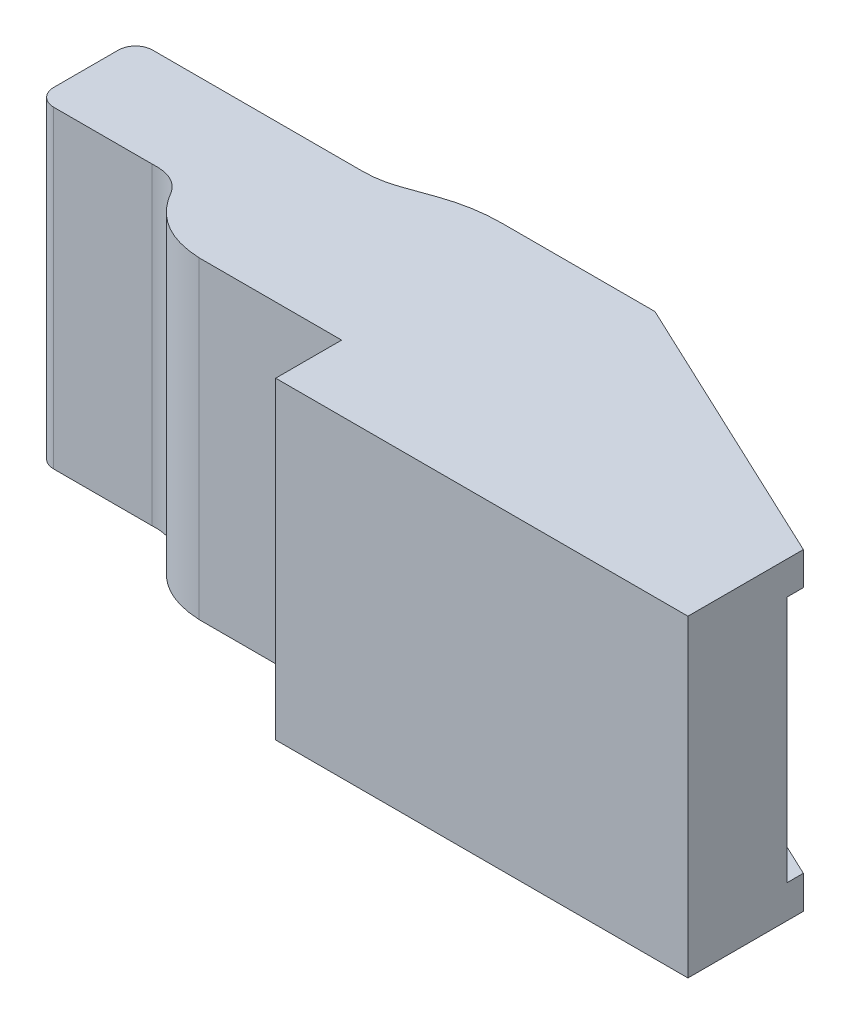
from build123d import *

# Parameters (mm, degrees)
BOSS_EXTRUDE1_DEPTH = 19
SHELL1_START        = 2
SHELL1_DEPTH        = 15
SKETCH3_W           = 1.941176471
SKETCH3_H           = 15
CUT_EXTRUDE1_DEPTH  = 19
SKETCH4_W           = 27
SKETCH4_H           = 15
CUT_EXTRUDE2_DEPTH  = 32
BOSS_EXTRUDE2_REACH = 53.488
SKETCH5_W           = 2
SKETCH5_H           = 15
BOSS_EXTRUDE3_DEPTH = 2
SKETCH9_W           = 25
SKETCH9_H           = 19
BOSS_EXTRUDE4_DEPTH = 4


# Read off the part's stored shape, not the designer's step: Shell1
with BuildPart() as part:
    # Sketch1 → Boss-Extrude1 (new body)
    with BuildSketch(Plane(origin=(0, 0, 0), x_dir=(1, 0, 0), z_dir=(0, 1, 0))):
        with BuildLine():
            Line((1.038993018, 3.5), (7, 3.5))
            add(Edge.make_bspline(
                [(7, 3.5), (8.459278233, 3.59711175), (9.130651495, 2.496759959)],
                knots=[0, 0, 0, 1, 1, 1], degree=2))
            add(Edge.make_bspline(
                [(13.357309771, 0), (11.472981218, 0.082883183), (10.064095126, 0.915136502), (9.130651495, 2.496759959)],
                knots=[0.099588888, 0.099588888, 0.099588888, 0.099588888, 1, 1, 1, 1], degree=3))
            Line((13.357309771, 0), (47, 0))
            Line((47, 0), (47, 3))
            Line((47, 3), (30, 11))
            Line((30, 11), (20.724531658, 11))
            ThreePointArc((20.724531658, 11), (19.025085695, 10.854536185), (17.375081312, 10.422376684))
            Line((17.375081312, 10.422376684), (15.713240119, 9.83162822))
            ThreePointArc((15.713240119, 9.83162822), (14.765930685, 9.583514472), (13.790235586, 9.5))
            Line((13.790235586, 9.5), (1.038993018, 9.5))
            ThreePointArc((1.038993018, 9.5), (0.304314009, 9.195685991), (0, 8.461006982))
            Line((0, 8.461006982), (0, 4.538993018))
            ThreePointArc((0, 4.538993018), (0.304314009, 3.804314009), (1.038993018, 3.5))
        make_face()
    extrude(amount=BOSS_EXTRUDE1_DEPTH)

    # Shell1 outline → Shell1 (cut)
    with BuildSketch(Plane(origin=(0, 0, 0), x_dir=(1, 0, 0), z_dir=(0, 1, 0)).offset(SHELL1_START)):
        with BuildLine():
            Line((2, 5.5), (6.940673062, 5.500000119))
            add(Edge.make_bspline(
                [(6.940673062, 5.500000119), (7.109177951, 5.50902653), (7.278234995, 5.512602664), (7.447878181, 5.510422658), (7.618098093, 5.502157784), (7.78882908, 5.487449259), (7.959932498, 5.465914346), (8.131179576, 5.437162857), (8.302237446, 5.400821142), (8.47266191, 5.356560666), (8.641900457, 5.304128263), (8.809309112, 5.243375169), (8.974186651, 5.174281921), (9.219363913, 5.057026039), (9.302034833, 5.014883346), (9.383743481, 4.970562513), (9.464391034, 4.924089732), (9.543880108, 4.875502014), (9.622116004, 4.824846185), (9.699007976, 4.772177888), (9.774470476, 4.71756058), (9.848424417, 4.661064529), (9.920798428, 4.602765816), (9.991530106, 4.542745331), (10.060567276, 4.481087773), (10.161520229, 4.386277087), (10.194737041, 4.354285549), (10.227514411, 4.321917126), (10.25984764, 4.289182819), (10.291732596, 4.256093529), (10.323165718, 4.222660069), (10.354144009, 4.188893152), (10.384665044, 4.154803401), (10.414726966, 4.120401341), (10.444328485, 4.085697407), (10.47346888, 4.050701936), (10.502148, 4.015425173), (10.544475391, 3.962103314), (10.558469269, 3.944261494), (10.572347936, 3.926353044), (10.586111461, 3.908379178), (10.599759937, 3.890341094), (10.613293488, 3.872239973), (10.626712261, 3.854076975), (10.640016431, 3.835853244), (10.6532062, 3.817569903), (10.666281796, 3.799228059), (10.679243473, 3.7808288), (10.692091515, 3.762373195), (10.711193584, 3.734606845), (10.717532595, 3.725337582), (10.723843304, 3.716054631), (10.730125756, 3.706758115), (10.736379994, 3.697448159), (10.742606064, 3.688124887), (10.748804009, 3.678788423), (10.754973874, 3.669438891), (10.761115703, 3.660076416), (10.76722954, 3.650701121), (10.77331543, 3.641313131), (10.779373416, 3.63191257), (10.788418607, 3.617793057), (10.791426708, 3.613083439), (10.794427853, 3.608370721), (10.797422049, 3.603654918), (10.800409303, 3.598936043), (10.803389621, 3.594214111), (10.806363009, 3.589489136), (10.809329475, 3.584761133), (10.812289025, 3.580030115), (10.815241666, 3.575296097), (10.818187405, 3.570559093), (10.821126247, 3.565819118), (10.824791189, 3.559890452), (10.825523747, 3.558704534), (10.826255874, 3.557518432), (10.826987571, 3.556332144), (10.827718838, 3.555145673), (10.828449675, 3.553959018), (10.829180081, 3.552772178), (10.829910058, 3.551585155), (10.830639605, 3.550397949), (10.831368723, 3.54921056), (10.83209741, 3.548022987), (10.832825669, 3.546835232), (10.833735455, 3.54535031), (10.833917386, 3.545053315), (10.834099289, 3.544756307), (10.834281166, 3.544459289), (10.834463016, 3.544162259), (10.834644839, 3.543865217), (10.834826636, 3.543568164), (10.835008405, 3.5432711), (10.835190148, 3.542974025), (10.835371864, 3.542676938), (10.835553553, 3.542379839), (10.835735215, 3.54208273), (10.836007668, 3.541637048), (10.836098479, 3.541488485), (10.836189283, 3.541339918), (10.836280081, 3.541191349), (10.836370872, 3.541042777), (10.836461656, 3.540894203), (10.836552434, 3.540745625), (10.836643204, 3.540597045), (10.836733968, 3.540448461), (10.836824726, 3.540299875), (10.836915476, 3.540151286), (10.83700622, 3.540002694), (10.837142326, 3.539779803), (10.837187693, 3.539705504), (10.837233059, 3.539631206), (10.837278422, 3.539556906), (10.837323784, 3.539482606), (10.837369144, 3.539408305), (10.837414503, 3.539334004), (10.83745986, 3.539259701), (10.837505215, 3.539185398), (10.837550569, 3.539111095), (10.83759592, 3.53903679), (10.837641271, 3.538962485), (10.837697956, 3.538869603), (10.837709293, 3.538851026), (10.83772063, 3.53883245), (10.837731967, 3.538813873), (10.837743304, 3.538795297), (10.83775464, 3.53877672), (10.837765977, 3.538758143), (10.837777313, 3.538739566), (10.83778865, 3.53872099), (10.837799986, 3.538702413), (10.837811322, 3.538683836), (10.837822658, 3.538665259), (10.837839662, 3.538637393), (10.83784533, 3.538628105), (10.837850998, 3.538618816), (10.837856665, 3.538609528), (10.837862333, 3.538600239), (10.837868001, 3.538590951), (10.837873669, 3.538581662), (10.837879336, 3.538572374), (10.837885004, 3.538563085), (10.837890672, 3.538553797), (10.83789634, 3.538544508), (10.837902007, 3.538535219), (10.837913343, 3.538516642), (10.837916038, 3.538512225), (10.837946561, 3.538462199), (10.83784979, 3.538620803), (10.838122406, 3.538173997), (10.837653087, 3.53894319), (10.838244889, 3.537973253), (10.837760219, 3.538767605), (10.838033901, 3.538319054), (10.837937534, 3.538476994), (10.837963449, 3.53843452), (10.837964102, 3.538433451), (10.83798002, 3.538407361), (10.837992755, 3.53838649), (10.838005489, 3.538365619), (10.838018224, 3.538344747), (10.838030958, 3.538323876), (10.838043693, 3.538303005), (10.838056427, 3.538282134), (10.838069162, 3.538261262), (10.838081896, 3.538240391), (10.838094631, 3.53821952), (10.838107365, 3.538198648), (10.8381201, 3.538177777), (10.838336586, 3.537822965), (10.838540338, 3.537489024), (10.838744091, 3.537155083), (10.838947843, 3.536821142), (10.839151595, 3.536487201), (10.839355347, 3.53615326), (10.839559099, 3.535819319), (10.839762851, 3.535485379), (10.839966603, 3.535151438), (10.840170355, 3.534817497), (10.840374107, 3.534483556), (10.840577859, 3.534149615), (10.841151786, 3.533208975), (10.84152196, 3.532602276), (10.841892134, 3.531995576), (10.842262308, 3.531388877), (10.842632482, 3.530782178), (10.843002656, 3.530175479), (10.84337283, 3.529568779), (10.843743004, 3.52896208), (10.844113178, 3.528355381), (10.844483352, 3.527748682), (10.844853526, 3.527141983), (10.8452237, 3.526535283), (10.845593874, 3.525928584)],
                knots=[0.016399164, 0.016399164, 0.016399164, 0.016399164, 0.016399164, 0.016399164, 0.016399164, 0.016399164, 0.016399164, 0.016399164, 0.016399164, 0.016399164, 0.016399164, 0.016399164, 0.505, 0.505, 0.505, 0.505, 0.505, 0.505, 0.505, 0.505, 0.505, 0.505, 0.505, 0.505, 0.7575, 0.7575, 0.7575, 0.7575, 0.7575, 0.7575, 0.7575, 0.7575, 0.7575, 0.7575, 0.7575, 0.7575, 0.88375, 0.88375, 0.88375, 0.88375, 0.88375, 0.88375, 0.88375, 0.88375, 0.88375, 0.88375, 0.88375, 0.88375, 0.946875, 0.946875, 0.946875, 0.946875, 0.946875, 0.946875, 0.946875, 0.946875, 0.946875, 0.946875, 0.946875, 0.946875, 0.9784375, 0.9784375, 0.9784375, 0.9784375, 0.9784375, 0.9784375, 0.9784375, 0.9784375, 0.9784375, 0.9784375, 0.9784375, 0.9784375, 0.99421875, 0.99421875, 0.99421875, 0.99421875, 0.99421875, 0.99421875, 0.99421875, 0.99421875, 0.99421875, 0.99421875, 0.99421875, 0.99421875, 0.998164063, 0.998164063, 0.998164063, 0.998164063, 0.998164063, 0.998164063, 0.998164063, 0.998164063, 0.998164063, 0.998164063, 0.998164063, 0.998164063, 0.999150391, 0.999150391, 0.999150391, 0.999150391, 0.999150391, 0.999150391, 0.999150391, 0.999150391, 0.999150391, 0.999150391, 0.999150391, 0.999150391, 0.999643555, 0.999643555, 0.999643555, 0.999643555, 0.999643555, 0.999643555, 0.999643555, 0.999643555, 0.999643555, 0.999643555, 0.999643555, 0.999643555, 0.999890137, 0.999890137, 0.999890137, 0.999890137, 0.999890137, 0.999890137, 0.999890137, 0.999890137, 0.999890137, 0.999890137, 0.999890137, 0.999890137, 0.999951782, 0.999951782, 0.999951782, 0.999951782, 0.999951782, 0.999951782, 0.999951782, 0.999951782, 0.999951782, 0.999951782, 0.999951782, 0.999951782, 0.999982605, 0.999982605, 0.999982605, 0.999982605, 0.999982605, 0.999982605, 0.999982605, 0.999982605, 0.999982605, 0.999982605, 0.999982605, 0.999982605, 1.000013428, 1.000013428, 1.000013428, 1.000013428, 1.000013428, 1.000013428, 1.000013428, 1.000013428, 1.000013428, 1.000013428, 1.000013428, 1.000013428, 1.000136719, 1.000136719, 1.000136719, 1.000136719, 1.000136719, 1.000136719, 1.000136719, 1.000136719, 1.000136719, 1.000136719, 1.000136719, 1.000136719, 1.002109375, 1.002109375, 1.002109375, 1.002109375, 1.002109375, 1.002109375, 1.002109375, 1.002109375, 1.002109375, 1.002109375, 1.002109375, 1.002109375, 1.00569327, 1.00569327, 1.00569327, 1.00569327, 1.00569327, 1.00569327, 1.00569327, 1.00569327, 1.00569327, 1.00569327, 1.00569327, 1.00569327, 1.00569327, 1.00569327], degree=13))
            add(Edge.make_bspline(
                [(13.40502786, 2.000000011), (13.264344282, 2.007348761), (13.129461459, 2.018818573), (13.000298688, 2.034202634), (12.876741801, 2.053292288), (12.758634127, 2.075880248), (12.645770972, 2.101768123), (12.53789756, 2.130776865), (12.43471047, 2.162758716), (12.335862518, 2.197609267), (12.24097111, 2.235278213), (12.149630028, 2.2757774), (12.061424662, 2.319184765), (11.975950656, 2.365642759), (11.85043569, 2.440707527), (11.808649689, 2.466910979), (11.767427174, 2.493986159), (11.726719836, 2.521963241), (11.68648208, 2.550876142), (11.64667126, 2.580762055), (11.607247906, 2.611660969), (11.568175964, 2.643615195), (11.529423015, 2.676668893), (11.490960519, 2.710867597), (11.452764036, 2.746257739), (11.414813464, 2.782886175), (11.377093268, 2.820799712), (11.320842431, 2.879667092), (11.302146827, 2.899622258), (11.283504508, 2.919916022), (11.264914303, 2.940554181), (11.246375261, 2.961542442), (11.227886646, 2.982886421), (11.209447946, 3.004591639), (11.191058864, 3.026663528), (11.172719324, 3.049107427), (11.154429467, 3.071928583), (11.136189656, 3.095132152), (11.118000471, 3.118723197), (11.099862709, 3.14270669), (11.072734729, 3.179277921), (11.063705051, 3.191567735), (11.054688524, 3.203957503), (11.045685321, 3.216447775), (11.036695613, 3.2290391), (11.02771957, 3.241732028), (11.018757363, 3.25452711), (11.009809165, 3.267424893), (11.000875145, 3.280425929), (10.991955475, 3.293530767), (10.983050326, 3.306739957), (10.974159869, 3.320054049), (10.965284275, 3.333473592), (10.951993435, 3.353761908), (10.947566934, 3.360551162), (10.943144241, 3.367366957), (10.938725387, 3.374209352), (10.934310402, 3.381078406), (10.929899315, 3.387974178), (10.925492157, 3.394896728), (10.921088956, 3.401846114), (10.916689746, 3.408822396), (10.912294553, 3.415825632), (10.907903408, 3.422855882), (10.903516342, 3.429913206), (10.899133385, 3.436997661), (10.892565157, 3.44766513), (10.890376783, 3.45122775), (10.888189448, 3.454797173), (10.886003158, 3.458373406), (10.883817916, 3.461956456), (10.881633726, 3.46554633), (10.879450592, 3.469143034), (10.877268519, 3.472746575), (10.875087511, 3.47635696), (10.872907571, 3.479974196), (10.870728705, 3.483598289), (10.868550916, 3.487229246), (10.866374209, 3.490867075), (10.863654681, 3.495422958), (10.863110843, 3.496334564), (10.862567074, 3.4972466), (10.862023372, 3.498159067), (10.861479738, 3.499071963), (10.860936173, 3.49998529), (10.860392676, 3.500899047), (10.859849247, 3.501813235), (10.859305886, 3.502727853), (10.858762594, 3.503642901), (10.85821937, 3.504558381), (10.857676215, 3.505474291), (10.857133128, 3.506390633), (10.856454356, 3.507536598), (10.856318605, 3.507765818), (10.856182859, 3.507995065), (10.856047118, 3.508224339), (10.85591138, 3.50845364), (10.855775648, 3.508682968), (10.855639918, 3.508912322), (10.855504195, 3.509141704), (10.855368474, 3.509371113), (10.855232759, 3.509600548), (10.855097047, 3.509830011), (10.85496134, 3.510059501), (10.854825637, 3.510289017), (10.854622089, 3.510633332), (10.854554241, 3.510748111), (10.854486393, 3.510862896), (10.854418547, 3.510977688), (10.854350702, 3.511092487), (10.854282858, 3.511207292), (10.854215016, 3.511322104), (10.854147174, 3.511436923), (10.854079333, 3.511551749), (10.854011494, 3.511666581), (10.853943655, 3.51178142), (10.853875818, 3.511896266), (10.853807981, 3.512011119), (10.853706228, 3.512183408), (10.853672311, 3.512240839), (10.853638394, 3.512298272), (10.853604477, 3.512355707), (10.85357056, 3.512413143), (10.853536644, 3.512470581), (10.853502728, 3.512528021), (10.853468812, 3.512585463), (10.853434897, 3.512642906), (10.853400982, 3.512700351), (10.853367066, 3.512757797), (10.853333152, 3.512815245), (10.853299237, 3.512872695), (10.853256845, 3.51294451), (10.853248366, 3.512958873), (10.853239888, 3.512973236), (10.853231409, 3.512987599), (10.853222931, 3.513001962), (10.853214452, 3.513016326), (10.853205974, 3.513030689), (10.853197496, 3.513045053), (10.853189017, 3.513059417), (10.853180539, 3.513073781), (10.85317206, 3.513088145), (10.853163582, 3.513102509), (10.853155104, 3.513116873), (10.853138147, 3.513145601), (10.85312929, 3.513160607), (10.853122642, 3.51317187), (10.853113824, 3.513186812), (10.853080604, 3.513243094), (10.853183622, 3.513068551), (10.852898834, 3.513551077), (10.85334732, 3.512791183), (10.852811074, 3.513699781), (10.853221217, 3.513004843), (10.853004235, 3.513372494), (10.853047842, 3.513298607), (10.853028513, 3.513331359), (10.852991521, 3.513394037), (10.85296686, 3.513435823), (10.852942199, 3.513477609), (10.852917538, 3.513519394), (10.852892877, 3.51356118), (10.852868216, 3.513602966), (10.852843554, 3.513644752), (10.852818894, 3.513686537), (10.852794232, 3.513728323), (10.852769571, 3.513770109), (10.85274491, 3.513811894), (10.852720249, 3.51385368), (10.852695588, 3.513895466), (10.852276349, 3.514605823), (10.851881771, 3.515274394), (10.851487193, 3.515942965), (10.851092615, 3.516611537), (10.850698037, 3.517280108), (10.85030346, 3.517948679), (10.849908881, 3.518617251), (10.849514304, 3.519285822), (10.849119726, 3.519954393), (10.848725148, 3.520622965), (10.84833057, 3.521291536), (10.847935992, 3.521960107), (10.847541414, 3.522628678), (10.847035911, 3.523485202), (10.846924985, 3.523673155), (10.846814059, 3.523861107), (10.846703133, 3.52404906), (10.846592207, 3.524237012), (10.846481281, 3.524424964), (10.846370355, 3.524612917), (10.846259429, 3.524800869), (10.846148503, 3.524988822), (10.846037577, 3.525176774), (10.845926651, 3.525364727), (10.845815726, 3.525552679), (10.8457048, 3.525740632), (10.845593874, 3.525928584)],
                knots=[0.108628768, 0.108628768, 0.108628768, 0.108628768, 0.108628768, 0.108628768, 0.108628768, 0.108628768, 0.108628768, 0.108628768, 0.108628768, 0.108628768, 0.108628768, 0.108628768, 0.108628768, 0.5542965, 0.5542965, 0.5542965, 0.5542965, 0.5542965, 0.5542965, 0.5542965, 0.5542965, 0.5542965, 0.5542965, 0.5542965, 0.5542965, 0.5542965, 0.781650305, 0.781650305, 0.781650305, 0.781650305, 0.781650305, 0.781650305, 0.781650305, 0.781650305, 0.781650305, 0.781650305, 0.781650305, 0.781650305, 0.781650305, 0.895327208, 0.895327208, 0.895327208, 0.895327208, 0.895327208, 0.895327208, 0.895327208, 0.895327208, 0.895327208, 0.895327208, 0.895327208, 0.895327208, 0.895327208, 0.95216566, 0.95216566, 0.95216566, 0.95216566, 0.95216566, 0.95216566, 0.95216566, 0.95216566, 0.95216566, 0.95216566, 0.95216566, 0.95216566, 0.95216566, 0.980584885, 0.980584885, 0.980584885, 0.980584885, 0.980584885, 0.980584885, 0.980584885, 0.980584885, 0.980584885, 0.980584885, 0.980584885, 0.980584885, 0.980584885, 0.994794498, 0.994794498, 0.994794498, 0.994794498, 0.994794498, 0.994794498, 0.994794498, 0.994794498, 0.994794498, 0.994794498, 0.994794498, 0.994794498, 0.994794498, 0.998346901, 0.998346901, 0.998346901, 0.998346901, 0.998346901, 0.998346901, 0.998346901, 0.998346901, 0.998346901, 0.998346901, 0.998346901, 0.998346901, 0.998346901, 0.999235002, 0.999235002, 0.999235002, 0.999235002, 0.999235002, 0.999235002, 0.999235002, 0.999235002, 0.999235002, 0.999235002, 0.999235002, 0.999235002, 0.999235002, 0.999679053, 0.999679053, 0.999679053, 0.999679053, 0.999679053, 0.999679053, 0.999679053, 0.999679053, 0.999679053, 0.999679053, 0.999679053, 0.999679053, 0.999679053, 0.999901078, 0.999901078, 0.999901078, 0.999901078, 0.999901078, 0.999901078, 0.999901078, 0.999901078, 0.999901078, 0.999901078, 0.999901078, 0.999901078, 0.999901078, 0.999956584, 0.999956584, 0.999956584, 0.999956584, 0.999956584, 0.999956584, 0.999956584, 0.999956584, 0.999956584, 0.999956584, 0.999956584, 0.999956584, 0.999956584, 1.00001209, 1.00001209, 1.00001209, 1.00001209, 1.00001209, 1.00001209, 1.00001209, 1.00001209, 1.00001209, 1.00001209, 1.00001209, 1.00001209, 1.00001209, 1.000123103, 1.000123103, 1.000123103, 1.000123103, 1.000123103, 1.000123103, 1.000123103, 1.000123103, 1.000123103, 1.000123103, 1.000123103, 1.000123103, 1.000123103, 1.001899305, 1.001899305, 1.001899305, 1.001899305, 1.001899305, 1.001899305, 1.001899305, 1.001899305, 1.001899305, 1.001899305, 1.001899305, 1.001899305, 1.001899305, 1.00239864, 1.00239864, 1.00239864, 1.00239864, 1.00239864, 1.00239864, 1.00239864, 1.00239864, 1.00239864, 1.00239864, 1.00239864, 1.00239864, 1.00239864, 1.00239864, 1.00239864], degree=14))
            Line((13.40502786, 2.000000011), (45, 2))
            Line((45, 2), (45, 3.941176471))
            Line((45, 3.941176471), (30, 11))
            Line((30, 11), (20.724531658, 11))
            Line((20.724531658, 11), (20.724531658, 9))
            ThreePointArc((20.724531658, 9), (19.364974888, 8.883628948), (18.044971381, 8.537901347))
            Line((18.044971381, 8.537901347), (16.383130188, 7.947152883))
            ThreePointArc((16.383130188, 7.947152883), (15.105819878, 7.612607235), (13.790235586, 7.5))
            Line((13.790235586, 7.5), (2, 7.5))
            Line((2, 7.5), (2, 5.5))
        make_face()
    extrude(amount=SHELL1_DEPTH, mode=Mode.SUBTRACT)

    # Sketch3 → Cut-Extrude1 (cut)
    with BuildSketch(Plane.ZY.offset(-45)):
        with Locations((-2.970588236, 9.5)):
            Rectangle(SKETCH3_W, SKETCH3_H)
    extrude(amount=-CUT_EXTRUDE1_DEPTH, mode=Mode.SUBTRACT)

    # Sketch4 → Cut-Extrude2 (cut)
    with BuildSketch(Plane(origin=(0, 0, -2), x_dir=(-1, 0, 0), z_dir=(0, 0, -1))):
        with Locations((-33.5, 9.5)):
            Rectangle(SKETCH4_W, SKETCH4_H)
    extrude(amount=CUT_EXTRUDE2_DEPTH, mode=Mode.SUBTRACT)

    # Boss-Extrude2: up to this plane
    boss_extrude2_end = Plane(origin=(-0.670110696, 19, -1.885095984), z_dir=(-0.33494503463592523, 0, -0.9422376684110751))
    # Sketch5 → Boss-Extrude2 (add, up to the surface)
    with BuildSketch(Plane(origin=(0, 0, -2), x_dir=(-1, 0, 0), z_dir=(0, 0, -1)), mode=Mode.PRIVATE) as boss_extrude2_sk1:
        with Locations((-19, 9.5)):
            Rectangle(SKETCH5_W, SKETCH5_H)
    boss_extrude2_tool1 = split(extrude(boss_extrude2_sk1.sketch, amount=BOSS_EXTRUDE2_REACH, mode=Mode.PRIVATE), bisect_by=boss_extrude2_end, keep=Keep.BOTH, mode=Mode.PRIVATE)
    add(boss_extrude2_tool1.solids().sort_by_distance((19, 9.5, -2))[0])

    # Sketch8 → Boss-Extrude3 (add)
    with BuildSketch(Plane(origin=(0, 0, -2), x_dir=(-1, 0, 0), z_dir=(0, 0, -1))):
        with BuildLine():
            ThreePointArc((-34, 9.5), (-38, 13.5), (-42, 9.5))
            Line((-42, 9.5), (-39.5, 9.5))
            ThreePointArc((-39.5, 9.5), (-38, 11), (-36.5, 9.5))
            Line((-36.5, 9.5), (-34, 9.5))
        make_face()
        with BuildLine():
            Line((-39.5, 9.5), (-42, 9.5))
            ThreePointArc((-42, 9.5), (-38, 5.5), (-34, 9.5))
            Line((-34, 9.5), (-36.5, 9.5))
            ThreePointArc((-36.5, 9.5), (-38, 8), (-39.5, 9.5))
        make_face()
        with BuildLine():
            ThreePointArc((-22, 9.5), (-26, 13.5), (-30, 9.5))
            Line((-30, 9.5), (-22, 9.5))
        make_face()
        with BuildLine():
            Line((-22, 9.5), (-30, 9.5))
            ThreePointArc((-30, 9.5), (-26, 5.5), (-22, 9.5))
        make_face()
    extrude(amount=BOSS_EXTRUDE3_DEPTH)

    # Sketch9 → Boss-Extrude4 (add)
    with BuildSketch(Plane.XY):
        with Locations((34.5, 9.5)):
            Rectangle(SKETCH9_W, SKETCH9_H)
    extrude(amount=BOSS_EXTRUDE4_DEPTH)


solid = part.part
